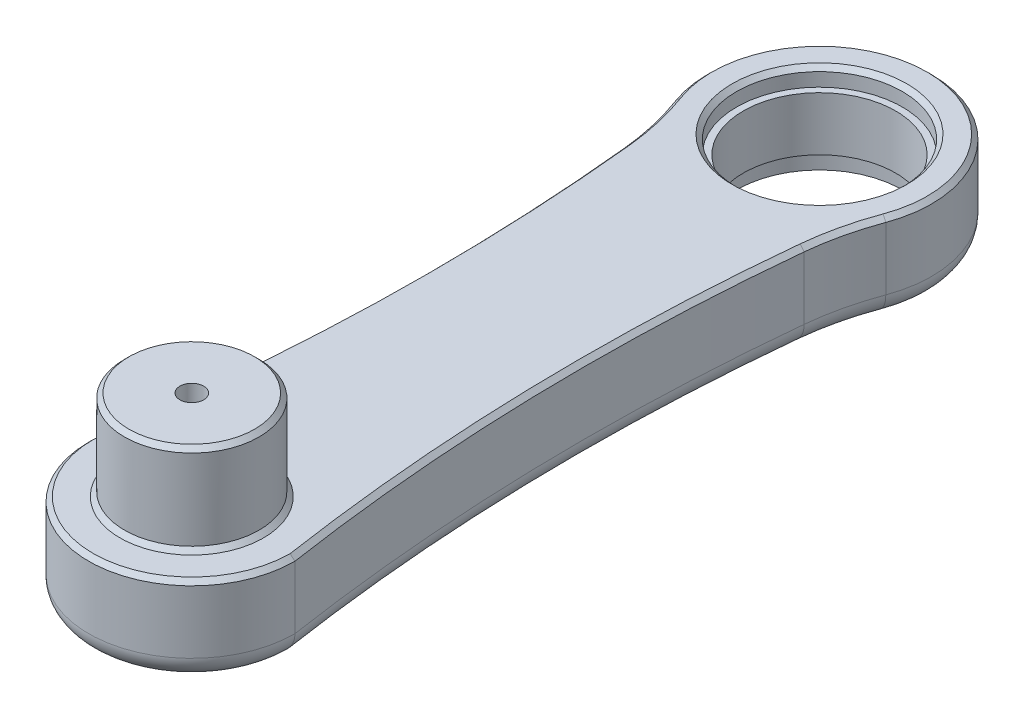
from build123d import *

# Parameters (mm, degrees)
BOSS_EXTRUDE1_DEPTH      = 20
SKETCH2_R                = 15.01
BOSS_EXTRUDE2_DEPTH      = 20
CHAMFER1_SIZE            = 1
SKETCH3_R                = 18.485
CUT_EXTRUDE1_DEPTH       = 20
CHAMFER3_SIZE            = 1
SKETCH5_R                = 2.65
CUT_EXTRUDE2_DEPTH       = 40
FILLET3_R                = 5
SKETCH6_R                = 3.65
CUT_EXTRUDE3_DEPTH       = 8
CHAMFER4_SIZE            = 0.5
BOSS_EXTRUDE3_DEPTH      = 6
BOSS_EXTRUDE3_DEPTH_BACK = 6
SKETCH7_R                = 18.485000000000003
SKETCH7_R_2              = 16.984999999999996


with BuildPart() as part:
    # Sketch1 → Boss-Extrude1 (new body)
    with BuildSketch(Plane(origin=(0, 0, 0), x_dir=(1, 0, 0), z_dir=(0, 1, 0))):
        with BuildLine():
            ThreePointArc((-23, 0), (1.41e-15, -22.999999999999982), (23, 0))
            ThreePointArc((23, 0), (17.845208734768505, 58.18386045047181), (20.033890701411753, 116.55459936267802))
            ThreePointArc((20.033890701411753, 116.55459936267802), (21.27316153822275, 124.05347023326534), (23.45051159720983, 131.33550314045155))
            ThreePointArc((23.45051159720983, 131.33550314045155), (-2.067e-14, 165.00000000000006), (-23.45051159720983, 131.3355031404515))
            ThreePointArc((-23.45051159720983, 131.3355031404515), (-21.27316153822273, 124.05347023326526), (-20.033890701411725, 116.55459936267786))
            ThreePointArc((-20.033890701411725, 116.55459936267786), (-17.845208734768505, 58.1838604504716), (-23, 0))
        make_face()
    extrude(amount=BOSS_EXTRUDE1_DEPTH)

    # Sketch2 → Boss-Extrude2 (add)
    with BuildSketch(Plane(origin=(0, 20, 0), x_dir=(1, 0, 0), z_dir=(0, 1, 0))):
        with Locations(Location((0, 0, 0), (0, 0, 90))):
            Circle(SKETCH2_R)
    extrude(amount=BOSS_EXTRUDE2_DEPTH)

    # Chamfer1
    chamfer1_edges = [part.edges().sort_by_distance(p)[0] for p in [
        (-2.76e-15, 40, 15.01),
    ]]
    chamfer(chamfer1_edges, length=CHAMFER1_SIZE)

    # Sketch3 → Cut-Extrude1 (cut)
    with BuildSketch(Plane(origin=(0, 20, 0), x_dir=(1, 0, 0), z_dir=(0, 1, 0))):
        with Locations(Location((0, 140.00000000000009, 0), (0, 0, 270))):
            Circle(SKETCH3_R)
    extrude(amount=-CUT_EXTRUDE1_DEPTH, mode=Mode.SUBTRACT)

    # Chamfer3
    # the kernel refuses this chamfer: 1 mm, written as the material it adds along each edge
    with BuildSketch(Plane(origin=(0, 20, 0), x_dir=(6e-17, 0, -1), z_dir=(1, 0, 6e-17))) as chamfer3_piece_1:
        Polygon((15.01, CHAMFER3_SIZE), (15.01 + CHAMFER3_SIZE, 0), (15.01, 0), align=None)
    revolve(axis=Axis((0, 20, 0), (0, 1, 0)))
    # the kernel refuses this chamfer: 1 mm, written as the material it takes off along each edge
    with BuildSketch(Plane(origin=(-79.73173943051358, 20, -110.54071067753486), x_dir=(0.9380204638883933, 0, -0.3465798743819428), z_dir=(-0.3465798743819428, 0, -0.9380204638883933))) as chamfer3_2_piece_1:
        Polygon((60.00000000000017 + CHAMFER3_SIZE, 0), (60.00000000000017, CHAMFER3_SIZE), (60.00000000000017, 0), align=None)
    revolve(axis=Axis((-79.73173943051358, 20, -110.54071067753486), (0, -1, 0)), revolution_arc=14.525766875036835, mode=Mode.SUBTRACT)
    with BuildSketch(Plane(origin=(-482.16572850262514, 20, -70.00000000000004), x_dir=(0.9949641454850282, 0, -0.1002314780857173), z_dir=(-0.1002314780857173, 0, -0.9949641454850282))) as chamfer3_2_piece_2:
        Polygon((464.4708454051196 + CHAMFER3_SIZE, 0), (464.4708454051196, CHAMFER3_SIZE), (464.4708454051196, 0), align=None)
    revolve(axis=Axis((-482.16572850262514, 20, -70.00000000000004), (0, -1, 0)), revolution_arc=14.737763084908373, mode=Mode.SUBTRACT)
    with BuildSketch(Plane(origin=(0, 20, -1.599e-14), x_dir=(-0.9937354343699007, 0, -0.11175816067592001), z_dir=(0.11175816067592001, 0, -0.9937354343699007))) as chamfer3_2_piece_3:
        Polygon((23.000000000000004 - CHAMFER3_SIZE, 0), (23.000000000000004, -CHAMFER3_SIZE), (23.000000000000004, 0), align=None)
    revolve(axis=Axis((0, 20, -1.599e-14), (0, 1, 0)), revolution_arc=192.83335153216495, mode=Mode.SUBTRACT)
    with BuildSketch(Plane(origin=(482.16572850261997, 20, -69.99999999999986), x_dir=(-0.9877285445231084, 0, 0.15618041597544133), z_dir=(0.15618041597544133, 0, 0.9877285445231084))) as chamfer3_2_piece_4:
        Polygon((464.4708454051149 + CHAMFER3_SIZE, 0), (464.47084540511446, CHAMFER3_SIZE), (464.4708454051149, 0), align=None)
    revolve(axis=Axis((482.16572850261997, 20, -69.99999999999986), (0, -1, 0)), revolution_arc=14.737763084908554, mode=Mode.SUBTRACT)
    with BuildSketch(Plane(origin=(0, 20, -140.00000000000009), x_dir=(-1.8e-16, 0, 1), z_dir=(-1, 0, -1.8e-16))) as chamfer3_2_piece_5:
        Polygon((18.485 + CHAMFER3_SIZE, 0), (18.485, -CHAMFER3_SIZE), (18.485, 0), align=None)
    revolve(axis=Axis((0, 20, -140.00000000000009), (0, 1, 0)), mode=Mode.SUBTRACT)
    with BuildSketch(Plane(origin=(79.7317394305139, 20, -110.54071067753493), x_dir=(-0.9949641454850281, 0, -0.10023147808571735), z_dir=(-0.10023147808571735, 0, 0.9949641454850281))) as chamfer3_2_piece_6:
        Polygon((60.000000000000455 + CHAMFER3_SIZE, 0), (60.000000000000455, CHAMFER3_SIZE), (60.000000000000455, 0), align=None)
    revolve(axis=Axis((79.7317394305139, 20, -110.54071067753493), (0, -1, 0)), revolution_arc=14.525766875036666, mode=Mode.SUBTRACT)
    with BuildSketch(Plane(origin=(9.77e-15, 20, -140.00000000000006), x_dir=(0.9380204638883942, 0, 0.3465798743819405), z_dir=(-0.3465798743819405, 0, 0.9380204638883942))) as chamfer3_2_piece_7:
        Polygon((24.999999999999982 - CHAMFER3_SIZE, 0), (24.999999999999982, -CHAMFER3_SIZE), (24.999999999999982, 0), align=None)
    revolve(axis=Axis((9.77e-15, 20, -140.00000000000006), (0, 1, 0)), revolution_arc=220.55653408148345, mode=Mode.SUBTRACT)

    # Sketch5 → Cut-Extrude2 (cut)
    with BuildSketch(Plane(origin=(0, 40, 0), x_dir=(1, 0, 0), z_dir=(0, 1, 0))):
        with Locations(Location((0, 0, 0), (0, 0, 270))):
            Circle(SKETCH5_R)
    extrude(amount=-CUT_EXTRUDE2_DEPTH, mode=Mode.SUBTRACT)

    # Fillet3
    # the kernel refuses this fillet: 5 mm, written as the material it takes off along each edge
    with BuildSketch(Plane(origin=(482.16572850261997, 0, -69.99999999999986), x_dir=(-0.9868985080370148, 0, 0.1613422909045059), z_dir=(0.1613422909045059, 0, 0.9868985080370148))) as fillet3_piece_1:
        with BuildLine():
            CenterArc((464.4708454051144 + FILLET3_R, -FILLET3_R), FILLET3_R, 89.99999999999935, 90.00000000000068)
            Line((464.4708454051144 + FILLET3_R, 8.9e-16), (464.4708454051144 + FILLET3_R, FILLET3_R * 0.02))
            Line((464.4708454051144 + FILLET3_R, FILLET3_R * 0.02), (464.4708454051144 - FILLET3_R * 0.02, FILLET3_R * 0.02))
            Line((464.4708454051144 - FILLET3_R * 0.02, FILLET3_R * 0.02), (464.4708454051144 - FILLET3_R * 0.02, -FILLET3_R))
            Line((464.4708454051144 - FILLET3_R * 0.02, -FILLET3_R), (464.4708454051144, -FILLET3_R))
        make_face()
    revolve(axis=Axis((482.16572850261997, 0, -69.99999999999986), (0, -1, 0)), revolution_arc=15.03731633345655, mode=Mode.SUBTRACT)
    with BuildSketch(Plane(origin=(0, 0, -1.599e-14), x_dir=(-0.9763879588864252, 0, -0.21602442857603077), z_dir=(0.21602442857603077, 0, -0.9763879588864252))) as fillet3_piece_2:
        with BuildLine():
            CenterArc((23 - FILLET3_R, FILLET3_R), FILLET3_R, 269.99999999999994, 90.00000000000006)
            Line((23 - FILLET3_R, -8.9e-16), (23 - FILLET3_R, -FILLET3_R * 0.02))
            Line((23 - FILLET3_R, -FILLET3_R * 0.02), (23 + FILLET3_R * 0.02, -FILLET3_R * 0.02))
            Line((23 + FILLET3_R * 0.02, -FILLET3_R * 0.02), (23 + FILLET3_R * 0.02, FILLET3_R))
            Line((23 + FILLET3_R * 0.02, FILLET3_R), (23.000000000000004, FILLET3_R))
        make_face()
    revolve(axis=Axis((0, 0, -1.599e-14), (0, 1, 0)), revolution_arc=204.95127041750123, mode=Mode.SUBTRACT)
    with BuildSketch(Plane(origin=(-482.16572850262514, 0, -70.00000000000004), x_dir=(0.9949641454850282, 0, -0.1002314780857173), z_dir=(-0.1002314780857173, 0, -0.9949641454850282))) as fillet3_piece_3:
        with BuildLine():
            CenterArc((464.4708454051196 + FILLET3_R, -FILLET3_R), FILLET3_R, 90, 90)
            Line((464.4708454051196 + FILLET3_R, 8.9e-16), (464.4708454051196 + FILLET3_R, FILLET3_R * 0.02))
            Line((464.4708454051196 + FILLET3_R, FILLET3_R * 0.02), (464.4708454051196 - FILLET3_R * 0.02, FILLET3_R * 0.02))
            Line((464.4708454051196 - FILLET3_R * 0.02, FILLET3_R * 0.02), (464.4708454051196 - FILLET3_R * 0.02, -FILLET3_R))
            Line((464.4708454051196 - FILLET3_R * 0.02, -FILLET3_R), (464.4708454051196, -FILLET3_R))
        make_face()
    revolve(axis=Axis((-482.16572850262514, 0, -70.00000000000004), (0, -1, 0)), revolution_arc=15.037316333456364, mode=Mode.SUBTRACT)
    with BuildSketch(Plane(origin=(-79.73173943051358, 0, -110.54071067753486), x_dir=(0.9380204638883933, 0, -0.3465798743819428), z_dir=(-0.3465798743819428, 0, -0.9380204638883933))) as fillet3_piece_4:
        with BuildLine():
            CenterArc((60.00000000000017 + FILLET3_R, -FILLET3_R), FILLET3_R, 90, 90)
            Line((60.00000000000017 + FILLET3_R, 8.9e-16), (60.00000000000017 + FILLET3_R, FILLET3_R * 0.02))
            Line((60.00000000000017 + FILLET3_R, FILLET3_R * 0.02), (60.00000000000017 - FILLET3_R * 0.02, FILLET3_R * 0.02))
            Line((60.00000000000017 - FILLET3_R * 0.02, FILLET3_R * 0.02), (60.00000000000017 - FILLET3_R * 0.02, -FILLET3_R))
            Line((60.00000000000017 - FILLET3_R * 0.02, -FILLET3_R), (60.00000000000018, -FILLET3_R))
        make_face()
    revolve(axis=Axis((-79.73173943051358, 0, -110.54071067753486), (0, -1, 0)), revolution_arc=14.525766875036835, mode=Mode.SUBTRACT)
    with BuildSketch(Plane(origin=(9.77e-15, 0, -140.00000000000006), x_dir=(0.9380204638883942, 0, 0.3465798743819405), z_dir=(-0.3465798743819405, 0, 0.9380204638883942))) as fillet3_piece_5:
        with BuildLine():
            CenterArc((24.999999999999982 - FILLET3_R, FILLET3_R), FILLET3_R, 270, 90)
            Line((24.999999999999982 - FILLET3_R, -8.9e-16), (24.999999999999982 - FILLET3_R, -FILLET3_R * 0.02))
            Line((24.999999999999982 - FILLET3_R, -FILLET3_R * 0.02), (24.999999999999982 + FILLET3_R * 0.02, -FILLET3_R * 0.02))
            Line((24.999999999999982 + FILLET3_R * 0.02, -FILLET3_R * 0.02), (24.999999999999982 + FILLET3_R * 0.02, FILLET3_R))
            Line((24.999999999999982 + FILLET3_R * 0.02, FILLET3_R), (24.999999999999986, FILLET3_R))
        make_face()
    revolve(axis=Axis((9.77e-15, 0, -140.00000000000006), (0, 1, 0)), revolution_arc=220.55653408148345, mode=Mode.SUBTRACT)
    with BuildSketch(Plane(origin=(79.7317394305139, 0, -110.54071067753493), x_dir=(-0.9949641454850281, 0, -0.10023147808571735), z_dir=(-0.10023147808571735, 0, 0.9949641454850281))) as fillet3_piece_6:
        with BuildLine():
            CenterArc((60.000000000000455 + FILLET3_R, -FILLET3_R), FILLET3_R, 90, 90)
            Line((60.000000000000455 + FILLET3_R, 8.9e-16), (60.000000000000455 + FILLET3_R, FILLET3_R * 0.02))
            Line((60.000000000000455 + FILLET3_R, FILLET3_R * 0.02), (60.000000000000455 - FILLET3_R * 0.02, FILLET3_R * 0.02))
            Line((60.000000000000455 - FILLET3_R * 0.02, FILLET3_R * 0.02), (60.000000000000455 - FILLET3_R * 0.02, -FILLET3_R))
            Line((60.000000000000455 - FILLET3_R * 0.02, -FILLET3_R), (60.000000000000455, -FILLET3_R))
        make_face()
    revolve(axis=Axis((79.7317394305139, 0, -110.54071067753493), (0, -1, 0)), revolution_arc=14.525766875036666, mode=Mode.SUBTRACT)

    # Sketch6 → Cut-Extrude3 (cut)
    with BuildSketch(Plane.XZ):
        with Locations(Location((0, 0, 0), (0, 0, 270))):
            Circle(SKETCH6_R)
    extrude(amount=-CUT_EXTRUDE3_DEPTH, mode=Mode.SUBTRACT)

    # Chamfer4
    chamfer4_edges = [part.edges().sort_by_distance(p)[0] for p in [
        (1.12e-15, 0, 3.65),
    ]]
    chamfer(chamfer4_edges, length=CHAMFER4_SIZE)

    # Sketch7 → Boss-Extrude3 (add, two sides: drawn at the far end of the back side and taken through both)
    with BuildSketch(Plane(origin=(0, 10, 0), x_dir=(1, 0, 0), z_dir=(0, 1, 0)).offset(-BOSS_EXTRUDE3_DEPTH_BACK)):
        with Locations(Location((0, 140.00000000000009, 0), (0, 0, 270))):
            Circle(SKETCH7_R)
        with Locations(Location((0, 140.00000000000009, 0), (0, 0, 270))):
            Circle(SKETCH7_R_2, mode=Mode.SUBTRACT)
    extrude(amount=BOSS_EXTRUDE3_DEPTH + BOSS_EXTRUDE3_DEPTH_BACK)


solid = part.part
